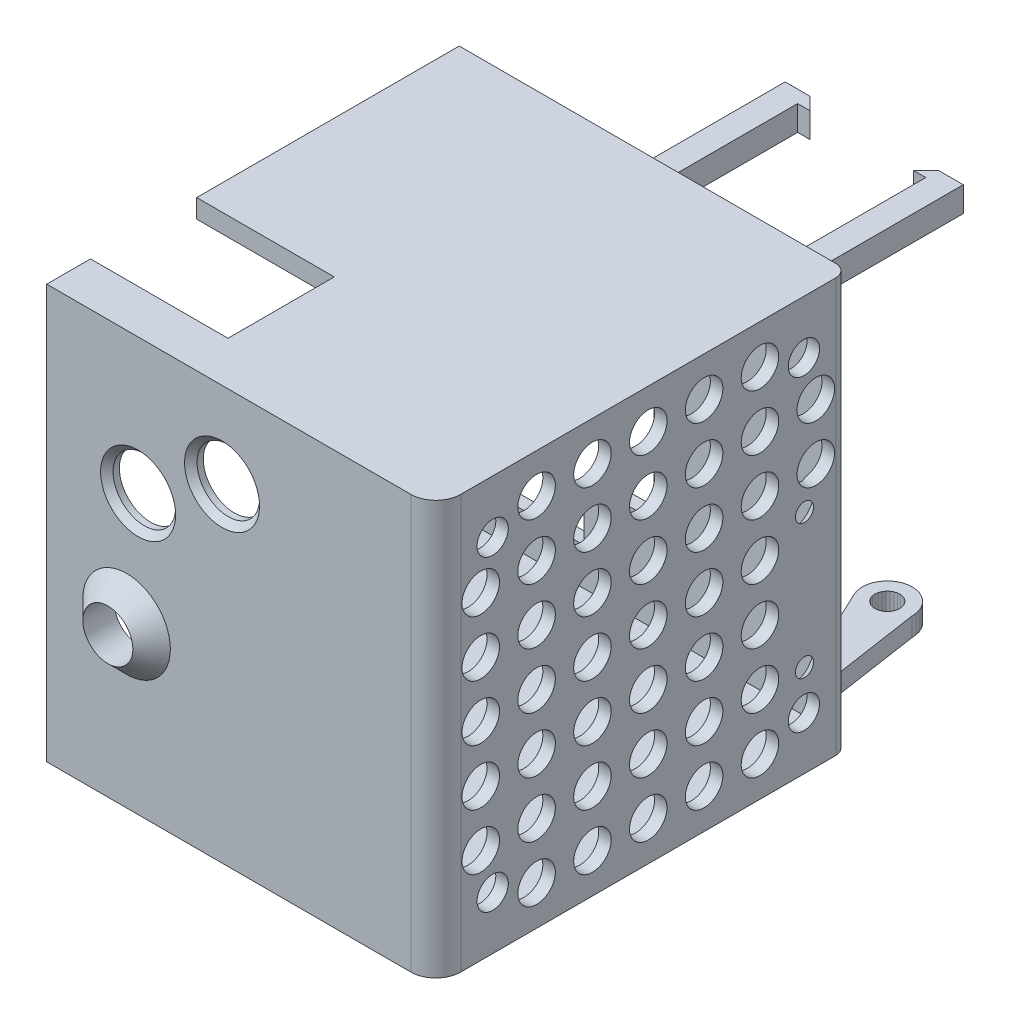
from build123d import *
from OCP.BRepAlgoAPI import BRepAlgoAPI_Cut
from OCP.TopTools import TopTools_ListOfShape

# Parameters (mm, degrees)
BOSS_EXTRUDE1_DEPTH     = 4.00000019
CUT_EXTRUDE1_DEPTH      = 73.57304405
CUT_EXTRUDE2_DEPTH      = 73.57304405
CUT_EXTRUDE3_DEPTH      = 73.57304405
CUT_EXTRUDE4_DEPTH      = 73.57304405
BOSS_EXTRUDE2_DEPTH     = 4.00000019
CUT_EXTRUDE5_DEPTH      = 4.00000019
DRAFT1_START            = 4.00000019
DRAFT1_DEPTH            = 4.00000019
DRAFT2_ANGLE            = 22.512585528
CUT_EXTRUDE6_DEPTH      = 10
CUT_EXTRUDE7_DEPTH      = 10
SKETCH18_W              = 1.999999397
SKETCH18_H              = 4.00000019
BOSS_EXTRUDE3_DEPTH     = 10.25
SKETCH24_W              = 1.999999397
SKETCH24_H              = 4.00000019
BOSS_EXTRUDE4_DEPTH     = 7
BOSS_EXTRUDE5_DEPTH     = 4
BOSS_EXTRUDE6_DEPTH     = 4
BOSS_EXTRUDE7_DEPTH     = 67.2
SKETCH49_W              = 28
SKETCH49_H              = 62
BOSS_EXTRUDE8_DEPTH     = 4
FILLET1_R               = 4
FILLET4_R               = 2
CUT_EXTRUDE11_START     = -1.999999
SKETCH51_R              = 1.3
CUT_EXTRUDE11_DEPTH     = 10
CUT_EXTRUDE12_DEPTH     = 10
SKETCH53_R              = 2.5
CUT_EXTRUDE13_DEPTH     = 10
SKETCH55_W              = 28
SKETCH55_H              = 62
BOSS_EXTRUDE9_DEPTH     = 3
CUT_EXTRUDE15_DEPTH     = 54
BOSS_EXTRUDE12_START    = -4
BOSS_EXTRUDE12_DEPTH    = 4
BOSS_EXTRUDE13_DEPTH    = 10.250000045
FILLET7_R               = 3
FILLET8_R               = 3
FILLET9_R               = 3
SKETCH63_W              = 7.950000044
SKETCH63_H              = 4
BOSS_EXTRUDE14_DEPTH    = 2
FILLET10_R              = 3
FILLET11_R              = 3
FILLET12_R              = 3
SKETCH64_W              = 5.050000044
SKETCH64_H              = 4
BOSS_EXTRUDE15_DEPTH    = 2
BOSS_EXTRUDE16_DEPTH    = 22
FILL_START              = 19.750000022
FILL_PATTERN3_OUTLINE_R = 3
FILL_PATTERN3_DEPTH     = 2
SKETCH82_R              = 5
CUT_EXTRUDE26_DEPTH     = 16
BOSS_EXTRUDE19_START    = -2
SKETCH86_R              = 3
BOSS_EXTRUDE19_DEPTH    = 2
SKETCH84_R              = 1.45
CUT_EXTRUDE30_DEPTH     = 2
CHAMFER1_SIZE           = 2
SKETCH87_R              = 4
CUT_EXTRUDE31_DEPTH     = 2
EXTRUDE_THIN2_START     = 4
SKETCH89_R              = 7
SKETCH89_R_2            = 4
EXTRUDE_THIN2_DEPTH     = 4
CHAMFER2_SIZE           = 4
SKETCH91_R              = 5
CUT_EXTRUDE32_DEPTH     = 4
CHAMFER3_SIZE           = 1


with BuildPart() as part:
    # Sketch1 → Boss-Extrude1 (new body)
    with BuildSketch(Plane.XZ):
        Polygon((-13.487846591, 10.461539305), (-10.908561759, 5.406746641), (-10.53722389, 4.897064995), (-10.090398602, 4.452077206), (-9.579190984, 4.08284273), (-9.016308002, 3.798539052), (-8.415737189, 3.606232349), (-7.792406715, 3.510701936), (-7.161808666, 3.514322219), (-6.539615802, 3.617003327), (-5.941292737, 3.816193435), (-5.381709896, 4.106941167), (-2.541664988, 5.435065832), (-1.802680898, 5.722791888), (-1.032205415, 5.910546053), (-0.243698538, 5.995049141), (0.549065589, 5.97482454), (1.332238084, 5.850226153), (2.0921377, 5.623429548), (2.815489657, 5.298397504), (3.489658004, 4.880807828), (4.1028657, 4.377955571), (4.644399974, 3.798624501), (5.104801618, 3.152935533), (5.476026796, 2.452167682), (5.751592107, 1.708562952), (5.926682614, 0.935111428), (5.998239852, 0.145324389), (5.965013988, -0.647001318), (5.82758477, -1.428024494), (5.588354077, -2.184101613), (5.25150029, -2.902024426), (3.884842154, -5.788090173), (3.65466834, -6.398444995), (3.526759101, -7.038095035), (3.504516324, -7.690028753), (3.588531632, -8.336909115), (3.776571015, -8.961531334), (4.063632805, -9.547285736), (4.442083184, -10.078594089), (4.901858047, -10.541325435), (5.430729128, -10.92317421), (6.01463113, -11.21398434), (6.63803611, -11.406023055), (7.284364663, -11.494183913), (7.93642737, -11.47611998), (8.576883934, -11.352313682), (9.188701399, -11.126056314), (9.755608626, -10.803367011), (10.262529366, -10.392824188), (10.695980862, -9.905349463), (11.044437066, -9.353904985), (11.298630387, -8.753156289), (11.451802216, -8.119081147), (11.499876156, -7.468542084), (15.499875881, 19.242942333), (15.751881525, 21.298639476), (15.893954784, 23.364847526), (15.925692394, 25.435687974), (15.847003087, 27.50528045), (15.658114105, 29.567731544), (15.359558165, 31.617186964), (14.952185564, 33.647812903), (14.437156729, 35.65384075), (13.815931976, 37.629559636), (13.090281747, 39.569359273), (12.262266129, 41.467722505), (11.334241368, 43.319251388), (10.308844037, 45.118685812), (9.18899104, 46.860903502), (7.977864705, 48.540953547), (6.678909995, 50.154060125), (5.295819137, 51.695637405), (3.832525341, 53.161296993), (2.293188358, 54.546877742), (0.682184997, 55.848442018), (-0.995904556, 57.062283158), (-2.736309078, 58.184951544), (-4.534080625, 59.213258326), (-6.384107284, 60.144275427), (-8.281129412, 60.975361615), (-10.219754651, 61.704147607), (-12.19446864, 62.32856214), (-14.199658297, 62.846839428), (-16.229623929, 63.257493079), (-18.278591335, 63.559360802), (-20.340736955, 63.751585782), (-22.410197183, 63.833624125), (-29.753083363, 64.247883856), (-30.411532149, 64.152754843), (-31.045103446, 63.949801028), (-31.636275351, 63.644647598), (-32.168693841, 63.245736063), (-32.627627254, 62.76409328), (-33.000383526, 62.213044614), (-33.27665478, 61.607833952), (-33.448789269, 60.965202749), (-33.512029797, 60.302931815), (-33.464632928, 59.639338404), (-33.30789879, 58.992780745), (-33.046174794, 58.381143957), (-32.686691731, 57.821344584), (-14.000000432, 12.735681608), (-14.000000432, 11.500000022), (-13.487846591, 11.500000022), align=None)
    extrude(amount=-BOSS_EXTRUDE1_DEPTH)

    # Sketch2 → Cut-Extrude1 (cut, through all)
    with BuildSketch(Plane.XZ):
        Polygon((-9.287265129, 6.602401845), (-9.032089263, 6.214424502), (-8.694317192, 5.895753391), (-8.292159066, 5.663568154), (-7.847296074, 5.530384369), (-7.383710239, 5.503383465), (-6.926393602, 5.584021099), (-6.500000134, 5.767948925), (-6.127516739, 6.045253016), (-5.829024129, 6.400981918), (-5.620614626, 6.815959699), (-5.51352324, 7.26781413), (-5.51352324, 7.732186001), (-5.620614626, 8.184039965), (-5.829024129, 8.599017747), (-6.127516739, 8.95474758), (-6.500000134, 9.232050739), (-6.926393602, 9.415979497), (-7.383710239, 9.4966162), (-7.847296074, 9.469616227), (-8.292159066, 9.336432442), (-8.694317192, 9.104246274), (-9.032089263, 8.785574697), (-9.287265129, 8.39759782), (-9.446090087, 7.961231284), (-9.499999695, 7.499999832), (-9.446090087, 7.038768381), align=None)
    extrude(amount=-CUT_EXTRUDE1_DEPTH, mode=Mode.SUBTRACT)

    # Sketch3 → Cut-Extrude2 (cut, through all)
    with BuildSketch(Plane.XZ):
        Polygon((-29.012316838, 61.121162027), (-29.25349772, 61.221063137), (-29.512317851, 61.255138367), (-29.77113612, 61.221063137), (-30.012317002, 61.121162027), (-30.219422653, 60.962241143), (-30.378341675, 60.755137354), (-30.478242785, 60.51395461), (-30.512318015, 60.255140066), (-30.478242785, 59.996318072), (-30.378341675, 59.755139053), (-30.219422653, 59.548031539), (-30.012317002, 59.389110655), (-29.77113612, 59.289209545), (-29.512317851, 59.25513804), (-29.25349772, 59.289209545), (-29.012316838, 59.389110655), (-28.805209324, 59.548031539), (-28.646292165, 59.755139053), (-28.546391055, 59.996318072), (-28.512317687, 60.255140066), (-28.546391055, 60.51395461), (-28.646292165, 60.755137354), (-28.805209324, 60.962241143), align=None)
    extrude(amount=-CUT_EXTRUDE2_DEPTH, mode=Mode.SUBTRACT)

    # Sketch4 → Cut-Extrude3 (cut, through all)
    with BuildSketch(Plane.XZ):
        Polygon((9.486476891, -7.26781413), (9.379385039, -6.815959699), (9.170975536, -6.400981918), (8.872482926, -6.045253016), (8.500000462, -5.767948925), (8.073606528, -5.584021099), (7.616289426, -5.503383465), (7.152703591, -5.530384369), (6.707840599, -5.663568154), (6.305682473, -5.895753391), (5.967911333, -6.214424502), (5.712734535, -6.602401845), (5.553910043, -7.038768381), (5.49999997, -7.499999832), (5.553910043, -7.961231284), (5.712734535, -8.39759782), (5.967911333, -8.785574697), (6.305682473, -9.104246274), (6.707840599, -9.336432442), (7.152703591, -9.469616227), (7.616289426, -9.4966162), (8.073606528, -9.415979497), (8.500000462, -9.232050739), (8.872482926, -8.95474758), (9.170975536, -8.599017747), (9.379385039, -8.184039965), (9.486476891, -7.732186001), align=None)
    extrude(amount=-CUT_EXTRUDE3_DEPTH, mode=Mode.SUBTRACT)

    # Sketch5 → Cut-Extrude4 (cut, through all)
    with BuildSketch(Plane(origin=(0, 4.00000019, 0), x_dir=(-1, 0, 0), z_dir=(0, 1, 0))):
        Polygon((-10.533951223, 18.984125927), (-10.499875993, 19.242942333), (-10.533951223, 19.501762465), (-10.633851402, 19.742943347), (-10.792769492, 19.950050861), (-10.999876074, 20.108968019), (-11.241056956, 20.208869129), (-11.499876156, 20.242942497), (-11.758695357, 20.208869129), (-11.999876238, 20.108968019), (-12.206982821, 19.950050861), (-12.365901843, 19.742943347), (-12.465802021, 19.501762465), (-12.49987632, 19.242942333), (-12.465802021, 18.984125927), (-12.365901843, 18.742943183), (-12.206982821, 18.535837531), (-11.999876238, 18.37691851), (-11.758695357, 18.2770174), (-11.499876156, 18.242942169), (-11.241056956, 18.2770174), (-10.999876074, 18.37691851), (-10.792769492, 18.535837531), (-10.633851402, 18.742943183), align=None)
    extrude(amount=-CUT_EXTRUDE4_DEPTH, mode=Mode.SUBTRACT)

    # Sketch6 → Boss-Extrude2 (add)
    with BuildSketch(Plane(origin=(0, 4.00000019, 0), x_dir=(-1, 0, 0), z_dir=(0, 1, 0))):
        Polygon((-11.500000022, 13.000000268), (-11.500000022, 14.999999665), (9.499999695, 54.60819602), (11.500000022, 54.60819602), (11.500000022, 13.000000268), align=None)
    extrude(amount=BOSS_EXTRUDE2_DEPTH)

    # Sketch7 → Cut-Extrude5 (cut)
    with BuildSketch(Plane(origin=(0, 8.00000038, 0), x_dir=(-1, 0, 0), z_dir=(0, 1, 0))):
        Polygon((-9.963010871, 14.90277441), (9.695886634, 14.999999665), (9.512844495, 52.011027932), align=None)
    extrude(amount=-CUT_EXTRUDE5_DEPTH, mode=Mode.SUBTRACT)

    # Draft1: read off the stored shape, not the designer's step
    # Draft1 outline → Draft1 (cut)
    with BuildSketch(Plane(origin=(0, 0, 0), x_dir=(1, 0, 0), z_dir=(0, 1, 0)).offset(DRAFT1_START)):
        Polygon((9.963010871, -14.90277441), (6.293578941, -13.000000268), (-9.705777853, -13.000000268), (-9.695886634, -14.999999665), align=None)
    extrude(amount=DRAFT1_DEPTH, mode=Mode.SUBTRACT)

    # Draft2
    draft2_faces = [part.faces().sort_by_distance(p)[0] for p in [
        (-13.487846591, 2.000000095, 10.980769663),
    ]]
    draft(draft2_faces, Plane(origin=(-14.000000432, 4.00000019, 11.500000022), x_dir=(-1, 0, 0), z_dir=(0, 0, -1)), DRAFT2_ANGLE)

    # Sketch10 → Cut-Extrude6 (cut)
    with BuildSketch(Plane(origin=(0, 0, 0), x_dir=(1, 0, 0), z_dir=(0, 1, 0))):
        Polygon((4.699187921, -14.999999665), (-51.704668768, -14.999999665), (-51.704668768, -70.877004863), (25.711675894, -70.877004863), (25.711675894, -14.999999665), align=None)
    extrude(amount=CUT_EXTRUDE6_DEPTH, mode=Mode.SUBTRACT)

    # Sketch13 → Cut-Extrude7 (cut)
    with BuildSketch(Plane(origin=(0, 0, 0), x_dir=(1, 0, 0), z_dir=(0, 1, 0))):
        Polygon((-14.000000432, -12.735681608), (-13.487846591, -11.500000022), (-14.000000432, -11.500000022), align=None)
    extrude(amount=CUT_EXTRUDE7_DEPTH, mode=Mode.SUBTRACT)

    # Sketch18 → Boss-Extrude3 (add)
    with BuildSketch(Plane(origin=(11.500000022, 0, 0), x_dir=(0, 0, -1), z_dir=(1, 0, 0))):
        with Locations((-13.999999967, 6.000000285)):
            Rectangle(SKETCH18_W, SKETCH18_H)
    extrude(amount=BOSS_EXTRUDE3_DEPTH)

    # Sketch24 → Boss-Extrude4 (add)
    with BuildSketch(Plane.ZY.offset(11.500000022)):
        with Locations((13.999999967, 6.000000285)):
            Rectangle(SKETCH24_W, SKETCH24_H)
    extrude(amount=BOSS_EXTRUDE4_DEPTH)

    # Sketch31 → Boss-Extrude5 (add)
    with BuildSketch(Plane(origin=(0, 4.00000019, 0), x_dir=(-1, 0, 0), z_dir=(0, -1, 0))):
        Polygon((18.500000022, -13.000000268), (18.500000022, -14.999999665), (14.938494173, -14.999999665), (14.109552801, -13.000000268), align=None)
    extrude(amount=BOSS_EXTRUDE5_DEPTH)

    # Sketch39 → Boss-Extrude6 (add)
    with BuildSketch(Plane(origin=(0, 4.00000019, 0), x_dir=(-1, 0, 0), z_dir=(0, -1, 0))):
        Polygon((-21.750000022, -14.999999665), (-21.750000022, -13.000000268), (-14.56500584, -13.000000268), (-14.864502375, -14.999999665), align=None)
    extrude(amount=BOSS_EXTRUDE6_DEPTH)

    # Sketch44 → Boss-Extrude7 (add)
    with BuildSketch(Plane.XZ):
        Polygon((-18.500000022, 13.000000268), (-18.500000022, 14.999999665), (19.750000022, 14.999999665), (19.750000022, 76.999999665), (-8.249999978, 76.999999665), (-8.249999978, 78.999999665), (-6.249999978, 78.999999665), (21.750000022, 78.999999665), (21.750000022, 14.999999665), (21.750000022, 13.000000268), align=None)
    extrude(amount=-BOSS_EXTRUDE7_DEPTH)

    # Sketch49 → Boss-Extrude8 (add)
    with BuildSketch(Plane.XZ):
        with Locations((5.750000022, 45.999999665)):
            Rectangle(SKETCH49_W, SKETCH49_H)
    extrude(amount=-BOSS_EXTRUDE8_DEPTH)

    # Fillet1
    fillet1_edges = [part.edges().sort_by_distance(p)[0] for p in [
        (21.750000022, 33.6, 78.999999665),
    ]]
    fillet(fillet1_edges, radius=FILLET1_R)

    # Fillet4
    fillet4_edges = [part.edges().sort_by_distance(p)[0] for p in [
        (21.750000022, 33.600000047, 13.000000268),
    ]]
    fillet(fillet4_edges, radius=FILLET4_R)


with BuildPart() as cut_extrude11_tool:
    # Sketch51 → Cut-Extrude11 (new body)
    with BuildSketch(Plane.XY.offset(14.999999665).offset(CUT_EXTRUDE11_START)):
        with Locations(Location((5.550000022, 59.7, 0), (0, 0, 270))):
            Circle(SKETCH51_R)
        with Locations(Location((5.550000022, 17.7, 0), (0, 0, 270))):
            Circle(SKETCH51_R)
        with Locations(Location((-3.449999978, 8.4, 0), (0, 0, 270))):
            Circle(SKETCH51_R)
    extrude(amount=CUT_EXTRUDE11_DEPTH)


with BuildPart() as part_1:
    add(part.part)

    # Cut-Extrude11: cut by cut_extrude11_tool, with a tolerance
    cut_extrude11_stock = TopTools_ListOfShape()
    cut_extrude11_stock.Append(part_1.part.wrapped)
    cut_extrude11_tools = TopTools_ListOfShape()
    cut_extrude11_tools.Append(cut_extrude11_tool.part.wrapped)
    cut_extrude11_cut = BRepAlgoAPI_Cut()
    cut_extrude11_cut.SetArguments(cut_extrude11_stock)
    cut_extrude11_cut.SetTools(cut_extrude11_tools)
    cut_extrude11_cut.SetFuzzyValue(0.00001)
    cut_extrude11_cut.Build()
    add(Compound.cast(cut_extrude11_cut.Shape()).solids(), mode=Mode.REPLACE)

    # Sketch52 → Cut-Extrude12 (cut)
    with BuildSketch(Plane.XY.offset(14.999999665)):
        Polygon((-10.549999978, 67.2), (-10.549999978, 59.2), (-7.349999978, 59.2), (-7.349999978, 19), (-18.500000022, 19), (-18.500000022, 67.2), align=None)
    extrude(amount=-CUT_EXTRUDE12_DEPTH, mode=Mode.SUBTRACT)

    # Sketch53 → Cut-Extrude13 (cut)
    with BuildSketch(Plane(origin=(21.750000022, 0, 0), x_dir=(0, 0, -1), z_dir=(1, 0, 0))):
        with Locations((-20.100000268, 58.7)):
            Circle(SKETCH53_R)
        with Locations(Location((-69.899999665, 58.7, 0), (0, 0, 180))):
            Circle(SKETCH53_R)
        with Locations((-20.100000268, 9.50000019)):
            Circle(SKETCH53_R)
        with Locations(Location((-69.899999665, 9.50000019, 0), (0, 0, 180))):
            Circle(SKETCH53_R)
    extrude(amount=-CUT_EXTRUDE13_DEPTH, mode=Mode.SUBTRACT)

    # Sketch55 → Boss-Extrude9 (add)
    with BuildSketch(Plane(origin=(0, 67.2, 0), x_dir=(1, 0, 0), z_dir=(0, 1, 0))):
        with Locations((5.750000022, -45.999999665)):
            Rectangle(SKETCH55_W, SKETCH55_H)
    extrude(amount=-BOSS_EXTRUDE9_DEPTH)

    # Sketch56 → Cut-Extrude15 (cut)
    with BuildSketch(Plane(origin=(21.750000022, 0, 0), x_dir=(0, 0, -1), z_dir=(1, 0, 0))):
        Polygon((-78.999999665, 0), (11.47611998, 0), (11.494183913, 0), (11.494183913, 1), (-78.999999665, 1), align=None)
    extrude(amount=-CUT_EXTRUDE15_DEPTH, mode=Mode.SUBTRACT)

    # Sketch61 → Boss-Extrude12 (add)
    with BuildSketch(Plane(origin=(0, 67.2, 0), x_dir=(1, 0, 0), z_dir=(0, 1, 0)).offset(BOSS_EXTRUDE12_START)):
        Polygon((15.050000022, -14.999999665), (15.050000022, 12.100000335), (11.050000022, 12.100000335), (9.050000022, 10.100000335), (11.050000022, 10.100000335), (11.050000022, -14.999999665), align=None)
        Polygon((-9.449999978, 12.100000335), (-13.449999978, 12.100000335), (-13.449999978, -14.999999665), (-9.449999978, -14.999999665), (-9.449999978, 10.100000335), (-7.449999978, 10.100000335), align=None)
    extrude(amount=-BOSS_EXTRUDE12_DEPTH)

    # Sketch62 → Boss-Extrude13 (add)
    with BuildSketch(Plane.ZY.offset(8.249999978)):
        Polygon((14.999999665, 1), (78.999999665, 1), (78.999999665, 67.2), (14.999999665, 67.2), (14.999999665, 64.2), (76.999999665, 64.2), (76.999999665, 4), (14.999999665, 4), align=None)
    extrude(amount=BOSS_EXTRUDE13_DEPTH)

    # Fillet7
    fillet7_edges = [part_1.edges().sort_by_distance(p)[0] for p in [
        (15.050000022, 61.2, 13.000000268),
    ]]
    fillet(fillet7_edges, radius=FILLET7_R)

    # Fillet8
    fillet8_edges = [part_1.edges().sort_by_distance(p)[0] for p in [
        (14.56500584, 2.500000095, 13.000000268),
    ]]
    fillet(fillet8_edges, radius=FILLET8_R)

    # Fillet9
    # the kernel refuses this fillet: 3 mm, written as the material it adds along each edge
    with BuildSketch(Plane(origin=(-14.109552801, 4.00000019, 13.000000268), x_dir=(-1, 0, 0), z_dir=(0, -1, 0))) as fillet9_piece_1:
        with BuildLine():
            CenterArc((2.004059645, 3), FILLET9_R, 202.512585528, 67.487414472)
            Line((-0.767326706, 1.851340916), (-1.044465341, 1.736475007))
            Line((-1.044465341, 1.736475007), (-0.200405958, -0.3))
            Line((-0.200405958, -0.3), (2.004059645, -0.3))
            Line((2.004059645, -0.3), (2.004059645, 0))
        make_face()
    extrude(amount=3.00000019)

    # Sketch63 → Boss-Extrude14 (add)
    with BuildSketch(Plane(origin=(0, 0, 14.999999665), x_dir=(-1, 0, 0), z_dir=(0, 0, -1))):
        with Locations((14.525, 65.2)):
            Rectangle(SKETCH63_W, SKETCH63_H)
    extrude(amount=BOSS_EXTRUDE14_DEPTH)

    # Fillet10
    fillet10_edges = [part_1.edges().sort_by_distance(p)[0] for p in [
        (14.550000022, 63.2, 13.000000268),
    ]]
    fillet(fillet10_edges, radius=FILLET10_R)

    # Fillet11
    fillet11_edges = [part_1.edges().sort_by_distance(p)[0] for p in [
        (14.550000022, 59.2, 13.000000268),
    ]]
    fillet(fillet11_edges, radius=FILLET11_R)


with BuildPart() as body_2:
    # Split1: read off the stored shape, not the designer's step
    # Split1: the piece on the far side of the plane
    add(part_1.part)
    split(bisect_by=Plane.YZ.offset(-13.449999978), keep=Keep.BOTTOM)


with BuildPart() as part_2:
    add(part_1.part)

    # Split1
    split(bisect_by=Plane.YZ.offset(-13.449999978), keep=Keep.TOP)

    # Fillet12
    # the kernel refuses this fillet: 3 mm, written as the material it adds along each edge
    with BuildSketch(Plane(origin=(-3.049999978, 63.2, 12.999999665), x_dir=(0, 0, -1), z_dir=(-1, 0, 0))) as fillet12_piece_1_section:
        with BuildLine():
            CenterArc((FILLET12_R, -FILLET12_R), FILLET12_R, 90, 90)
            Line((0, -FILLET12_R), (-FILLET12_R * 0.02, -FILLET12_R))
            Line((-FILLET12_R * 0.02, -FILLET12_R), (-FILLET12_R * 0.02, FILLET12_R * 0.02))
            Line((-FILLET12_R * 0.02, FILLET12_R * 0.02), (FILLET12_R, FILLET12_R * 0.02))
            Line((FILLET12_R, FILLET12_R * 0.02), (FILLET12_R, 0))
        make_face()
    fillet12_piece_1 = extrude(amount=10.4, mode=Mode.PRIVATE)
    fillet12_piece_1 = split(fillet12_piece_1, bisect_by=Plane(origin=(-9.449999978, 63.2, 12.999999665), z_dir=(-1, 0, 0)), keep=Keep.TOP, mode=Mode.PRIVATE)
    add(fillet12_piece_1)

    add(body_2.part)  # Boss-Extrude15 merges body 2
    # Sketch64 → Boss-Extrude15 (add)
    with BuildSketch(Plane.XY.offset(14.999999665)):
        with Locations((-15.975, 61.2)):
            Rectangle(SKETCH64_W, SKETCH64_H)
    extrude(amount=-BOSS_EXTRUDE15_DEPTH)

    # Sketch65 → Boss-Extrude16 (add)
    with BuildSketch(Plane.ZY.offset(18.500000022)):
        Polygon((12.999999665, 59.2), (12.999999665, 67.2), (54.999999665, 67.2), (54.999999665, 64.2), (14.999999665, 64.2), (14.999999665, 59.2), align=None)
        Polygon((78.999999665, 67.2), (71.999999665, 67.2), (71.999999665, 64.2), (76.999999665, 64.2), (76.999999665, 4), (14.999999665, 4), (14.999999665, 10), (13.000000268, 10), (13.000000268, 1), (78.999999665, 1), align=None)
    extrude(amount=BOSS_EXTRUDE16_DEPTH)

    # Fill Pattern3: read off the stored shape, not the designer's step
    # Fill Pattern3 outline → Fill Pattern3 (cut)
    with BuildSketch(Plane.YZ.offset(FILL_START)):
        with Locations((34.1, 44.999999966)):
            Circle(FILL_PATTERN3_OUTLINE_R)
        with Locations((51.968900277, 18.196649551)):
            Circle(FILL_PATTERN3_OUTLINE_R)
        with Locations((60.903350415, 27.13109969)):
            Circle(FILL_PATTERN3_OUTLINE_R)
        with Locations((60.903350415, 36.065549828)):
            Circle(FILL_PATTERN3_OUTLINE_R)
        with Locations((60.903350415, 44.999999966)):
            Circle(FILL_PATTERN3_OUTLINE_R)
        with Locations((60.903350415, 62.868900243)):
            Circle(FILL_PATTERN3_OUTLINE_R)
        with Locations((34.1, 27.13109969)):
            Circle(FILL_PATTERN3_OUTLINE_R)
        with Locations((60.903350415, 53.934450105)):
            Circle(FILL_PATTERN3_OUTLINE_R)
        with Locations((25.165549862, 27.13109969)):
            Circle(FILL_PATTERN3_OUTLINE_R)
        with Locations((43.034450138, 18.196649551)):
            Circle(FILL_PATTERN3_OUTLINE_R)
        with Locations((34.1, 18.196649551)):
            Circle(FILL_PATTERN3_OUTLINE_R)
        with Locations((25.165549862, 18.196649551)):
            Circle(FILL_PATTERN3_OUTLINE_R)
        with Locations((16.231099723, 18.196649551)):
            Circle(FILL_PATTERN3_OUTLINE_R)
        with Locations((43.034450138, 53.934450105)):
            Circle(FILL_PATTERN3_OUTLINE_R)
        with Locations((7.296649585, 44.999999966)):
            Circle(FILL_PATTERN3_OUTLINE_R)
        with Locations((16.231099723, 53.934450105)):
            Circle(FILL_PATTERN3_OUTLINE_R)
        with Locations((34.1, 53.934450105)):
            Circle(FILL_PATTERN3_OUTLINE_R)
        with Locations((16.231099723, 62.868900243)):
            Circle(FILL_PATTERN3_OUTLINE_R)
        with Locations((7.296649585, 53.934450105)):
            Circle(FILL_PATTERN3_OUTLINE_R)
        with Locations((43.034450138, 44.999999966)):
            Circle(FILL_PATTERN3_OUTLINE_R)
        with Locations((25.165549862, 62.868900243)):
            Circle(FILL_PATTERN3_OUTLINE_R)
        with Locations((16.231099723, 36.065549828)):
            Circle(FILL_PATTERN3_OUTLINE_R)
        with Locations((25.165549862, 44.999999966)):
            Circle(FILL_PATTERN3_OUTLINE_R)
        with Locations((16.231099723, 27.13109969)):
            Circle(FILL_PATTERN3_OUTLINE_R)
        with Locations((25.165549862, 36.065549828)):
            Circle(FILL_PATTERN3_OUTLINE_R)
        with Locations((7.296649585, 36.065549828)):
            Circle(FILL_PATTERN3_OUTLINE_R)
        with Locations((16.231099723, 44.999999966)):
            Circle(FILL_PATTERN3_OUTLINE_R)
        with Locations((25.165549862, 53.934450105)):
            Circle(FILL_PATTERN3_OUTLINE_R)
        with Locations((7.296649585, 27.13109969)):
            Circle(FILL_PATTERN3_OUTLINE_R)
        with Locations((43.034450138, 71.803350382)):
            Circle(FILL_PATTERN3_OUTLINE_R)
        with Locations((51.968900277, 44.999999966)):
            Circle(FILL_PATTERN3_OUTLINE_R)
        with Locations((34.1, 71.803350382)):
            Circle(FILL_PATTERN3_OUTLINE_R)
        with Locations((51.968900277, 53.934450105)):
            Circle(FILL_PATTERN3_OUTLINE_R)
        with Locations((51.968900277, 36.065549828)):
            Circle(FILL_PATTERN3_OUTLINE_R)
        with Locations((51.968900277, 71.803350382)):
            Circle(FILL_PATTERN3_OUTLINE_R)
        with Locations((51.968900277, 27.13109969)):
            Circle(FILL_PATTERN3_OUTLINE_R)
        with Locations((43.034450138, 27.13109969)):
            Circle(FILL_PATTERN3_OUTLINE_R)
        with Locations((34.1, 36.065549828)):
            Circle(FILL_PATTERN3_OUTLINE_R)
        with Locations((34.1, 62.868900243)):
            Circle(FILL_PATTERN3_OUTLINE_R)
        with Locations((43.034450138, 36.065549828)):
            Circle(FILL_PATTERN3_OUTLINE_R)
        with Locations((7.296649585, 62.868900243)):
            Circle(FILL_PATTERN3_OUTLINE_R)
        with Locations((25.165549862, 71.803350382)):
            Circle(FILL_PATTERN3_OUTLINE_R)
        with Locations((51.968900277, 62.868900243)):
            Circle(FILL_PATTERN3_OUTLINE_R)
        with Locations((16.231099723, 71.803350382)):
            Circle(FILL_PATTERN3_OUTLINE_R)
        with Locations((43.034450138, 62.868900243)):
            Circle(FILL_PATTERN3_OUTLINE_R)
    extrude(amount=FILL_PATTERN3_DEPTH, mode=Mode.SUBTRACT)

    # Sketch82 → Cut-Extrude26 (cut)
    with BuildSketch(Plane.XY.offset(78.999999665)):
        with Locations((-12.449999978, 53.50000019)):
            Circle(SKETCH82_R)
    extrude(amount=-CUT_EXTRUDE26_DEPTH, mode=Mode.SUBTRACT)

    # Sketch86 → Boss-Extrude19 (add)
    with BuildSketch(Plane(origin=(21.750000022, 0, 0), x_dir=(0, 0, -1), z_dir=(1, 0, 0)).offset(BOSS_EXTRUDE19_START)):
        with Locations((-18.196649551, 16.231099723)):
            Circle(SKETCH86_R)
        with Locations((-18.196649551, 25.165549862)):
            Circle(SKETCH86_R)
        with Locations((-18.196649551, 34.1)):
            Circle(SKETCH86_R)
    extrude(amount=BOSS_EXTRUDE19_DEPTH)

    # Sketch84 → Cut-Extrude30 (cut)
    with BuildSketch(Plane.ZY.offset(-19.750000022)):
        with Locations((20.003632624, 15.755200644)):
            Circle(SKETCH84_R)
        with Locations((20.003632624, 37.255200644)):
            Circle(SKETCH84_R)
    extrude(amount=-CUT_EXTRUDE30_DEPTH, mode=Mode.SUBTRACT)

    # Chamfer1
    # the kernel refuses this chamfer: 2 mm, written as the material it takes off along each edge
    with BuildSketch(Plane(origin=(19.750000022, 15.755200644, 20.003632624), x_dir=(0, 0, 1), z_dir=(0, -1, 0))) as chamfer1_piece_1:
        Polygon((1.45 + CHAMFER1_SIZE, 0), (1.45, -CHAMFER1_SIZE), (1.45, 0), align=None)
    revolve(axis=Axis((19.750000022, 15.755200644, 20.003632624), (-1, 0, 0)), mode=Mode.SUBTRACT)
    with BuildSketch(Plane(origin=(19.750000022, 37.255200644, 20.003632624), x_dir=(0, 0, 1), z_dir=(0, -1, 0))) as chamfer1_piece_2:
        Polygon((1.45 + CHAMFER1_SIZE, 0), (1.45, -CHAMFER1_SIZE), (1.45, 0), align=None)
    revolve(axis=Axis((19.750000022, 37.255200644, 20.003632624), (-1, 0, 0)), mode=Mode.SUBTRACT)

    # Sketch87 → Cut-Extrude31 (cut)
    with BuildSketch(Plane.XY.offset(78.999999665)):
        with Locations((-27.721441476, 26.505200644)):
            Circle(SKETCH87_R)
    extrude(amount=-CUT_EXTRUDE31_DEPTH, mode=Mode.SUBTRACT)

    # Sketch89 → Extrude-Thin2 (add)
    with BuildSketch(Plane.XY.offset(78.999999665).offset(EXTRUDE_THIN2_START)):
        with Locations((-27.721441476, 26.505200644)):
            Circle(SKETCH89_R)
        with Locations((-27.721441476, 26.505200644)):
            Circle(SKETCH89_R_2, mode=Mode.SUBTRACT)
    extrude(amount=-EXTRUDE_THIN2_DEPTH)

    # Chamfer2
    # the kernel refuses this chamfer: 4 mm, written as the material it takes off along each edge
    with BuildSketch(Plane(origin=(-27.721441476, 26.505200644, 82.999999665), x_dir=(1, 0, 0), z_dir=(0, -1, 0))) as chamfer2_piece_1_section:
        Polygon((7, -CHAMFER2_SIZE), (7 - CHAMFER2_SIZE, 0), (7, 0), align=None)
    chamfer2_piece_1 = revolve(axis=Axis((-27.721441476, 26.505200644, 82.999999665), (0, 0, 1)), mode=Mode.PRIVATE)
    chamfer2_piece_1 = split(chamfer2_piece_1, bisect_by=Plane(origin=(-27.721441476, 26.505200644, 78.999999665), z_dir=(0, 0, 1)), keep=Keep.TOP, mode=Mode.PRIVATE)
    add(chamfer2_piece_1, mode=Mode.SUBTRACT)

    # Sketch91 → Cut-Extrude32 (cut)
    with BuildSketch(Plane.XY.offset(78.999999665)):
        with Locations((-25.88236322, 45.521451357)):
            Circle(SKETCH91_R)
    extrude(amount=-CUT_EXTRUDE32_DEPTH, mode=Mode.SUBTRACT)

    # Chamfer3
    chamfer3_edges = [part_2.edges().sort_by_distance(p)[0] for p in [
        (-17.449999978, 53.50000019, 78.999999665),
        (-30.88236322, 45.521451357, 78.999999665),
    ]]
    chamfer(chamfer3_edges, length=CHAMFER3_SIZE)


solid = part_2.part
